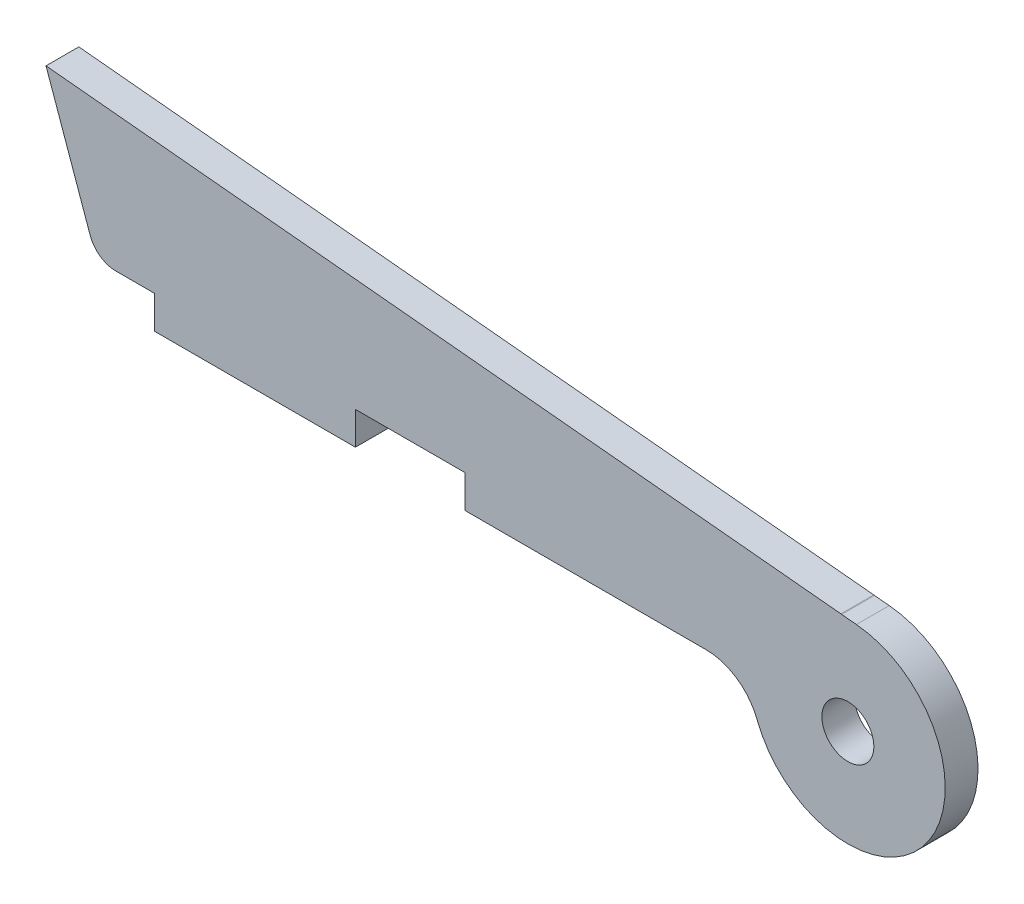
from build123d import *

# Parameters (mm, degrees)
SKETCH1_R           = 5.5
BOSS_EXTRUDE1_DEPTH = 3
MOVE_START          = -3
MOVE_FACE1_DEPTH    = 6
SKETCH3_R           = 17.792629247
SKETCH3_R_2         = 4.75
BOSS_EXTRUDE3_DEPTH = 6
FILLET3_R           = 147
FILLET4_R           = 10
SKETCH5_W           = 25
SKETCH5_H           = 6
SKETCH5_W_2         = 20
CUT_EXTRUDE1_DEPTH  = 123.739451528
MOVE_FACE2_DEPTH    = 6
FILLET5_R           = 5


with BuildPart() as part:
    # Sketch1 → Boss-Extrude1 (new, symmetric)
    with BuildSketch(Plane.XY):
        with BuildLine():
            Line((100.725085642, 12), (-7.531031869, 22.507881701))
            Line((-7.531031869, 22.507881701), (0, 0))
            Line((0, 0), (2.007571917, -6))
            Line((2.007571917, -6), (88.851239866, -6))
            ThreePointArc((88.851239866, -6), (98.632352269, -18.710186538), (113.423722773, -12.510641371))
            ThreePointArc((113.423722773, -12.510641371), (113.737903109, 3.196949424), (100.725085642, 12))
        make_face()
        with Locations((102, -6)):
            Circle(SKETCH1_R, mode=Mode.SUBTRACT)
    extrude(amount=BOSS_EXTRUDE1_DEPTH, both=True)

    # Move Face1: read off the stored shape, not the designer's step
    # Move Face1 outline → Move Face1 (add)
    with BuildSketch(Plane.XY.offset(MOVE_START)):
        Polygon((-7.531031869, 22.5078817), (-44.042319528, 26.051850395), (-33.317920404, -6), (2.007571917, -6), align=None)
    extrude(amount=MOVE_FACE1_DEPTH)

    # Sketch3 → Boss-Extrude3 (add)
    with BuildSketch(Plane.XY.offset(3)):
        with Locations((102, -6)):
            Circle(SKETCH3_R)
        with Locations((102, -6)):
            Circle(SKETCH3_R_2, mode=Mode.SUBTRACT)
    extrude(amount=-BOSS_EXTRUDE3_DEPTH)

    # Fillet3
    fillet3_edges = [part.edges().sort_by_distance(p)[0] for p in [
        (102.186094391, 11.791656034, 0),
    ]]
    fillet(fillet3_edges, radius=FILLET3_R)

    # Fillet4
    fillet4_edges = [part.edges().sort_by_distance(p)[0] for p in [
        (84.207370753, -6, 0),
    ]]
    fillet(fillet4_edges, radius=FILLET4_R)

    # Sketch5 → Cut-Extrude1 (cut, through all)
    with BuildSketch(Plane(origin=(0, 0, -3), x_dir=(-1, 0, 0), z_dir=(0, 0, -1))):
        with Locations((37.25, -3)):
            Rectangle(SKETCH5_W, SKETCH5_H)
        with Locations((-21.983719278, -3)):
            Rectangle(SKETCH5_W_2, SKETCH5_H)
    extrude(amount=-CUT_EXTRUDE1_DEPTH, mode=Mode.SUBTRACT)

    # Move Face2: read off the stored shape, not the designer's step
    # Move Face2 outline → Move Face2 (add)
    with BuildSketch(Plane.XY.offset(MOVE_START)):
        Polygon((-44.569041147, 26.102976637), (-35.325492321, 0), (-44.042319528, 26.051850395), align=None)
    extrude(amount=MOVE_FACE2_DEPTH)

    # Fillet5
    fillet5_edges = [part.edges().sort_by_distance(p)[0] for p in [
        (-35.325492321, 0, 0),
    ]]
    fillet(fillet5_edges, radius=FILLET5_R)


solid = part.part
